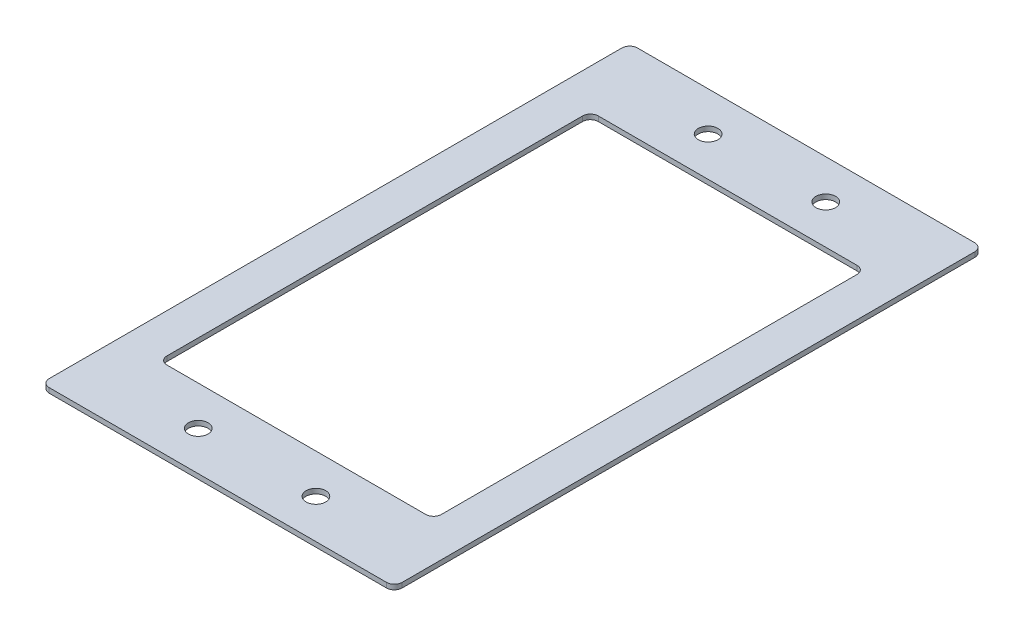
from build123d import *

# Parameters (mm, degrees)
SKETCH1_W           = 114.3
SKETCH1_H           = 190.5
SKETCH1_W_2         = 88.9
SKETCH1_H_2         = 139.7
BOSS_EXTRUDE1_DEPTH = 1.5875
SKETCH2_R           = 3.175
CUT_EXTRUDE1_DEPTH  = 4.7625
FILLET1_R           = 2.54
FILLET2_R           = 2.54


with BuildPart() as part:
    # Sketch1 → Boss-Extrude1 (new body)
    with BuildSketch(Plane(origin=(0, 0, 0), x_dir=(1, 0, 0), z_dir=(0, 1, 0))):
        Rectangle(SKETCH1_W, SKETCH1_H)
        Rectangle(SKETCH1_W_2, SKETCH1_H_2, mode=Mode.SUBTRACT)
    extrude(amount=BOSS_EXTRUDE1_DEPTH)

    # Sketch2 → Cut-Extrude1 (cut)
    with BuildSketch(Plane(origin=(0, 1.5875, 0), x_dir=(1, 0, 0), z_dir=(0, 1, 0))):
        with Locations((19.05, -82.55)):
            Circle(SKETCH2_R)
        with Locations((19.05, 82.55)):
            Circle(SKETCH2_R)
        with Locations((-19.05, -82.55)):
            Circle(SKETCH2_R)
        with Locations((-19.05, 82.55)):
            Circle(SKETCH2_R)
    extrude(amount=-CUT_EXTRUDE1_DEPTH, mode=Mode.SUBTRACT)

    # Fillet1
    fillet1_edges = [part.edges().sort_by_distance(p)[0] for p in [
        (44.45, 0.79375, -69.85),
        (-44.45, 0.79375, -69.85),
        (-44.45, 0.79375, 69.85),
        (44.45, 0.79375, 69.85),
    ]]
    fillet(fillet1_edges, radius=FILLET1_R)

    # Fillet2
    fillet2_edges = [part.edges().sort_by_distance(p)[0] for p in [
        (-57.15, 0.79375, 95.25),
        (-57.15, 0.79375, -95.25),
        (57.15, 0.79375, -95.25),
        (57.15, 0.79375, 95.25),
    ]]
    fillet(fillet2_edges, radius=FILLET2_R)


solid = part.part
